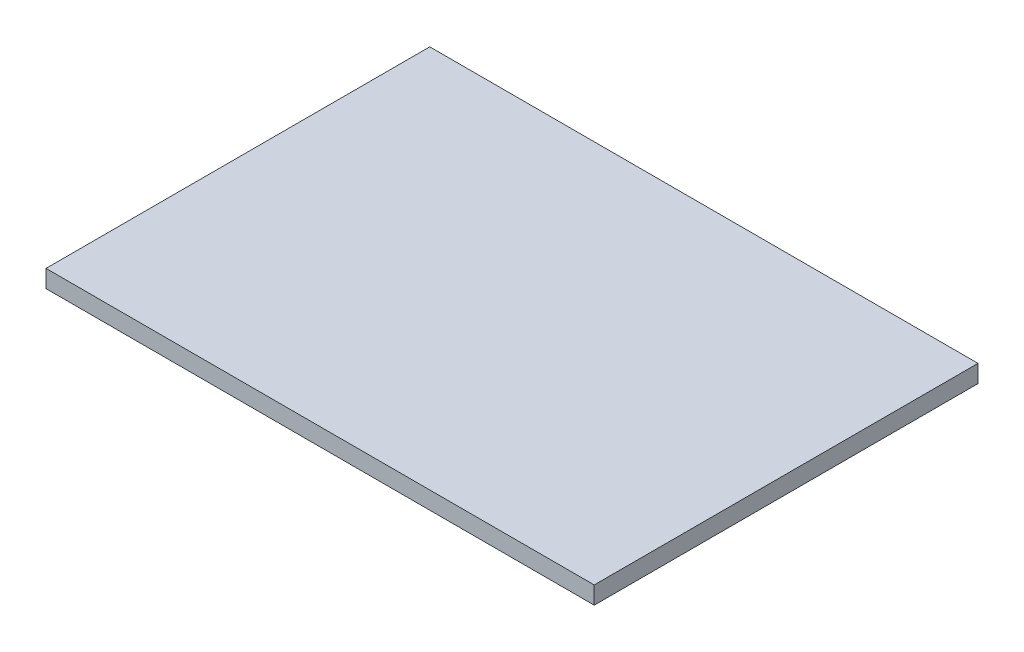
from build123d import *

# Parameters (mm, degrees)
SKETCH1_W           = 50
SKETCH1_H           = 35
BOSS_EXTRUDE1_DEPTH = 1.6


with BuildPart() as part:
    # Sketch1 → Boss-Extrude1 (new body)
    with BuildSketch(Plane(origin=(0, 0, 0), x_dir=(1, 0, 0), z_dir=(0, 1, 0))):
        with Locations((25, 17.5)):
            Rectangle(SKETCH1_W, SKETCH1_H)
    extrude(amount=BOSS_EXTRUDE1_DEPTH)


solid = part.part
